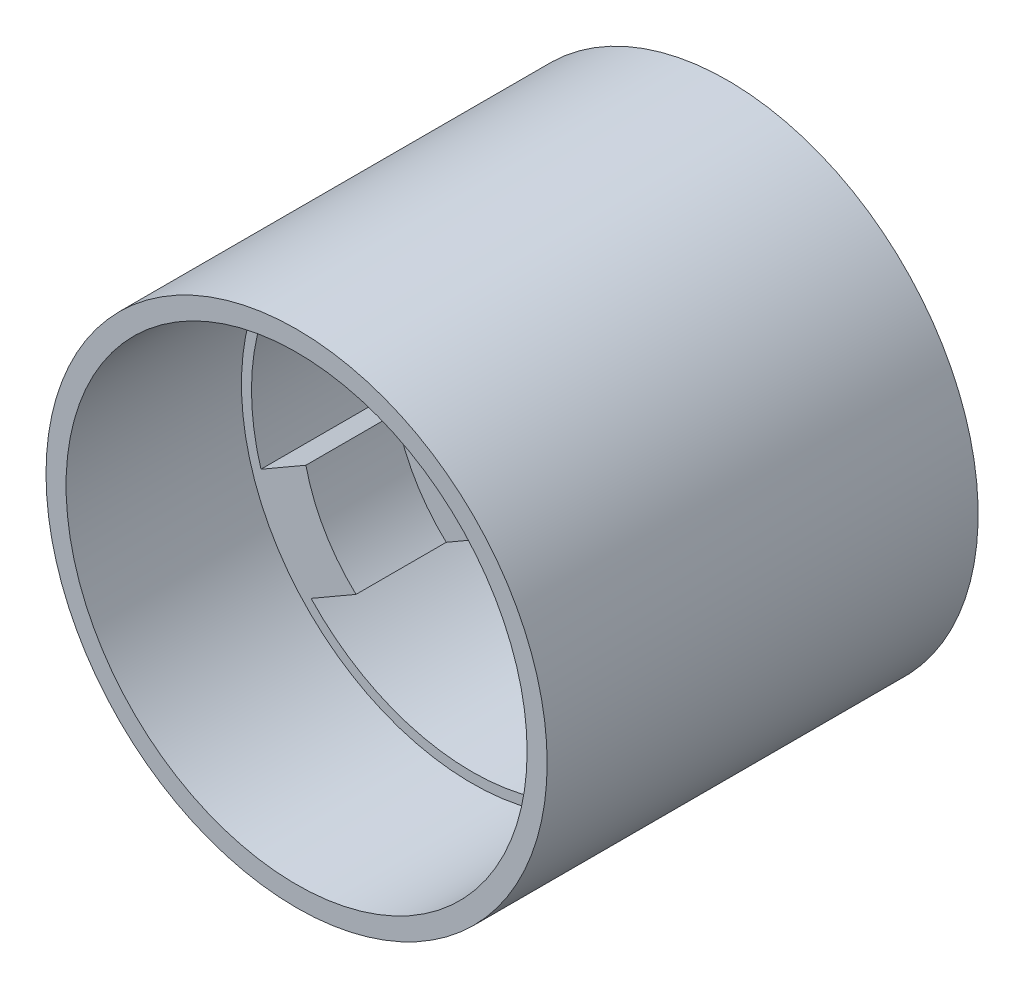
from build123d import *

# Parameters (mm, degrees)
SKETCH_1_R          = 22
SKETCH_1_R_2        = 17
EXTRUDE_1_DEPTH     = 9
EXTRUDE_START       = 3
SKETCH_2_R          = 22
EXTRUDE_2_DEPTH     = 3
SKETCH_3_R          = 1
CUT_EXTRUDE_1_DEPTH = 3
CUT_EXTRUDE_2_DEPTH = 25
SKETCH_5_R          = 4
CUT_EXTRUDE_3_DEPTH = 10
FILLET_1_R          = 10
FILLET_2_R          = 10
SKETCH_7_R          = 25
SKETCH_7_R_2        = 22
EXTRUDE_3_DEPTH     = 30
EXTRUDE_START_2     = 4
EXTRUDE_4_DEPTH     = 4
SKETCH_9_R          = 38.67245247
CUT_EXTRUDE_4_DEPTH = 1
EXTRUDE_START_3     = 13.5
SKETCH_10_R         = 25
SKETCH_10_R_2       = 22
EXTRUDE_5_DEPTH     = 13.5
SKETCH_11_R         = 23
CUT_EXTRUDE_5_DEPTH = 10.5
CHAMFER_2_SIZE      = 1
CUT_EXTRUDE_START   = -18
SKETCH_12_R         = 23
CUT_EXTRUDE_6_DEPTH = 18
SKETCH_13_R         = 39.83087954
CUT_EXTRUDE_7_DEPTH = 2.5
SKETCH_14_R         = 15
CUT_EXTRUDE_8_DEPTH = 0.2
SKETCH_15_R         = 25
SKETCH_15_R_2       = 23
EXTRUDE_6_DEPTH     = 2


with BuildPart() as part:
    # 草图1 → 凸台-拉伸1 (new body)
    with BuildSketch(Plane.XY):
        Circle(SKETCH_1_R)
        Circle(SKETCH_1_R_2, mode=Mode.SUBTRACT)
    extrude(amount=EXTRUDE_1_DEPTH)

    # 草图2 → 凸台-拉伸2 (add)
    with BuildSketch(Plane(origin=(0, 0, 0), x_dir=(-1, 0, 0), z_dir=(0, 0, -1)).offset(EXTRUDE_START)):
        Circle(SKETCH_2_R)
    extrude(amount=-EXTRUDE_2_DEPTH)

    # 草图3 → 切除-拉伸1 (cut)
    with BuildSketch(Plane(origin=(0, 0, -3), x_dir=(-1, 0, 0), z_dir=(0, 0, -1))):
        with Locations((0, 10)):
            Circle(SKETCH_3_R)
        with Locations((8.660254038, -5)):
            Circle(SKETCH_3_R)
        with Locations((-8.660254038, -5)):
            Circle(SKETCH_3_R)
    extrude(amount=-CUT_EXTRUDE_1_DEPTH, mode=Mode.SUBTRACT)

    # 草图4 → 切除-拉伸2 (cut)
    with BuildSketch(Plane(origin=(0, 0, -3), x_dir=(-1, 0, 0), z_dir=(0, 0, -1))):
        Polygon((24.787699458, -8.537682263), (5, 2.886751346), (5, 15), (5, 31.006622637), (28.596284234, 19.54376122), align=None)
        Polygon((-6.160254038, -9.330127019), (0, -5.773502692), (19.787699458, -17.197936301), (-4.03507969, -32.43608202), (-23.902747272, -19.573760264), align=None)
        Polygon((-5, 10), (-5, 2.886751346), (-28.902747272, -10.913506226), (-27.638085306, 27.170625695), (-5, 31.006622637), align=None)
    extrude(amount=-CUT_EXTRUDE_2_DEPTH, mode=Mode.SUBTRACT)

    # 草图5 → 切除-拉伸3 (cut)
    with BuildSketch(Plane(origin=(0, 0, -3), x_dir=(-1, 0, 0), z_dir=(0, 0, -1))):
        Circle(SKETCH_5_R)
    extrude(amount=-CUT_EXTRUDE_3_DEPTH, mode=Mode.SUBTRACT)

    # 圆角1
    fillet_1_edges = [part.edges().sort_by_distance(p)[0] for p in [
        (-5, 2.886751346, -1.5),
    ]]
    fillet(fillet_1_edges, radius=FILLET_1_R)

    # 圆角2
    fillet_2_edges = [part.edges().sort_by_distance(p)[0] for p in [
        (5, 2.886751346, -1.5),
        (0, -5.773502692, -1.5),
    ]]
    fillet(fillet_2_edges, radius=FILLET_2_R)

    # 草图7 → 凸台-拉伸3 (add)
    with BuildSketch(Plane(origin=(0, 0, -3), x_dir=(-1, 0, 0), z_dir=(0, 0, -1))):
        Circle(SKETCH_7_R)
        Circle(SKETCH_7_R_2, mode=Mode.SUBTRACT)
    extrude(amount=-EXTRUDE_3_DEPTH)

    # 草图8 → 凸台-拉伸4 (add)
    with BuildSketch(Plane(origin=(0, 0, -3), x_dir=(-1, 0, 0), z_dir=(0, 0, -1)).offset(EXTRUDE_START_2)):
        with BuildLine():
            Line((-21.053975315, -6.382015624), (-15.753584421, -3.321833514))
            ThreePointArc((-15.753584421, -3.321833514), (-13.943009001, -8.05), (-10.753584421, -11.982087552))
            Line((-10.753584421, -11.982087552), (-16.053975315, -15.042269662))
            ThreePointArc((-16.053975315, -15.042269662), (-19.052558883, -11), (-21.053975315, -6.382015624))
        make_face()
        with BuildLine():
            Line((16.053975315, -15.042269662), (10.753584421, -11.982087552))
            ThreePointArc((10.753584421, -11.982087552), (13.943009001, -8.05), (15.753584421, -3.321833514))
            Line((15.753584421, -3.321833514), (21.053975315, -6.382015624))
            ThreePointArc((21.053975315, -6.382015624), (19.052558883, -11), (16.053975315, -15.042269662))
        make_face()
        with BuildLine():
            Line((5, 21.424285286), (5, 15.303921066))
            ThreePointArc((5, 15.303921066), (0, 16.1), (-5, 15.303921066))
            Line((-5, 15.303921066), (-5, 21.424285286))
            ThreePointArc((-5, 21.424285286), (0, 22), (5, 21.424285286))
        make_face()
    extrude(amount=-EXTRUDE_4_DEPTH)

    # 草图9 → 切除-拉伸4 (cut)
    with BuildSketch(Plane(origin=(0, 0, -7), x_dir=(-1, 0, 0), z_dir=(0, 0, -1))):
        Circle(SKETCH_9_R)
    extrude(amount=-CUT_EXTRUDE_4_DEPTH, mode=Mode.SUBTRACT)

    # 草图10 → 凸台-拉伸5 (add)
    with BuildSketch(Plane(origin=(0, 0, -3), x_dir=(-1, 0, 0), z_dir=(0, 0, -1)).offset(EXTRUDE_START_3)):
        Circle(SKETCH_10_R)
        Circle(SKETCH_10_R_2, mode=Mode.SUBTRACT)
    extrude(amount=-EXTRUDE_5_DEPTH)

    # 草图11 → 切除-拉伸5 (cut)
    with BuildSketch(Plane(origin=(0, 0, -16.5), x_dir=(-1, 0, 0), z_dir=(0, 0, -1))):
        Circle(SKETCH_11_R)
    extrude(amount=-CUT_EXTRUDE_5_DEPTH, mode=Mode.SUBTRACT)

    # 倒角2
    chamfer_2_edges = [part.edges().sort_by_distance(p)[0] for p in [
        (23, 0, -16.5),
    ]]
    chamfer(chamfer_2_edges, length=CHAMFER_2_SIZE)

    # 草图12 → 切除-拉伸6 (cut)
    with BuildSketch(Plane.XY.offset(27).offset(CUT_EXTRUDE_START)):
        Circle(SKETCH_12_R)
    extrude(amount=CUT_EXTRUDE_6_DEPTH, mode=Mode.SUBTRACT)

    # 草图13 → 切除-拉伸7 (cut)
    with BuildSketch(Plane.XY.offset(27)):
        Circle(SKETCH_13_R)
    extrude(amount=-CUT_EXTRUDE_7_DEPTH, mode=Mode.SUBTRACT)

    # 草图14 → 切除-拉伸8 (cut)
    with BuildSketch(Plane(origin=(0, 0, -3), x_dir=(-1, 0, 0), z_dir=(0, 0, -1))):
        Circle(SKETCH_14_R)
    extrude(amount=-CUT_EXTRUDE_8_DEPTH, mode=Mode.SUBTRACT)

    # 草图15 → 凸台-拉伸6 (add)
    with BuildSketch(Plane.XY.offset(24.5)):
        Circle(SKETCH_15_R)
        Circle(SKETCH_15_R_2, mode=Mode.SUBTRACT)
    extrude(amount=EXTRUDE_6_DEPTH)


solid = part.part
